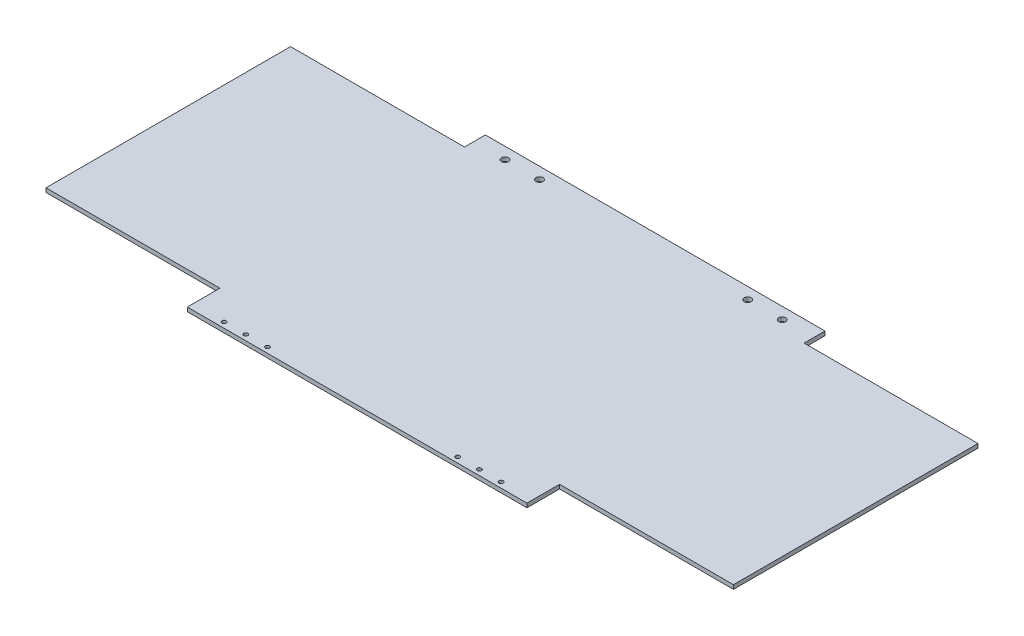
from build123d import *

# Parameters (mm, degrees)
SKETCH1_R           = 2.564
SKETCH1_R_2         = 1.54
BOSS_EXTRUDE1_DEPTH = 3


with BuildPart() as part:
    # Sketch1 → Boss-Extrude1 (new body)
    with BuildSketch(Plane(origin=(0, 0, 0), x_dir=(1, 0, 0), z_dir=(0, 1, 0))):
        Polygon((128, 0), (128, -24), (378, -24), (378, 0), (506, 0), (506, 180), (378, 180), (378, 195.398), (128, 195.398), (128, 180), (0, 180), (0, 0), align=None)
        with Locations((151, 186.858)):
            Circle(SKETCH1_R, mode=Mode.SUBTRACT)
        with Locations((176.4, 186.858)):
            Circle(SKETCH1_R, mode=Mode.SUBTRACT)
        with Locations((151, -20)):
            Circle(SKETCH1_R_2, mode=Mode.SUBTRACT)
        with Locations((183, -20)):
            Circle(SKETCH1_R_2, mode=Mode.SUBTRACT)
        with Locations((329.6, 186.858)):
            Circle(SKETCH1_R, mode=Mode.SUBTRACT)
        with Locations((355, 186.858)):
            Circle(SKETCH1_R, mode=Mode.SUBTRACT)
        with Locations((167, -20)):
            Circle(SKETCH1_R_2, mode=Mode.SUBTRACT)
        with Locations((323, -20)):
            Circle(SKETCH1_R_2, mode=Mode.SUBTRACT)
        with Locations((339, -20)):
            Circle(SKETCH1_R_2, mode=Mode.SUBTRACT)
        with Locations((355, -20)):
            Circle(SKETCH1_R_2, mode=Mode.SUBTRACT)
    extrude(amount=BOSS_EXTRUDE1_DEPTH)


solid = part.part
